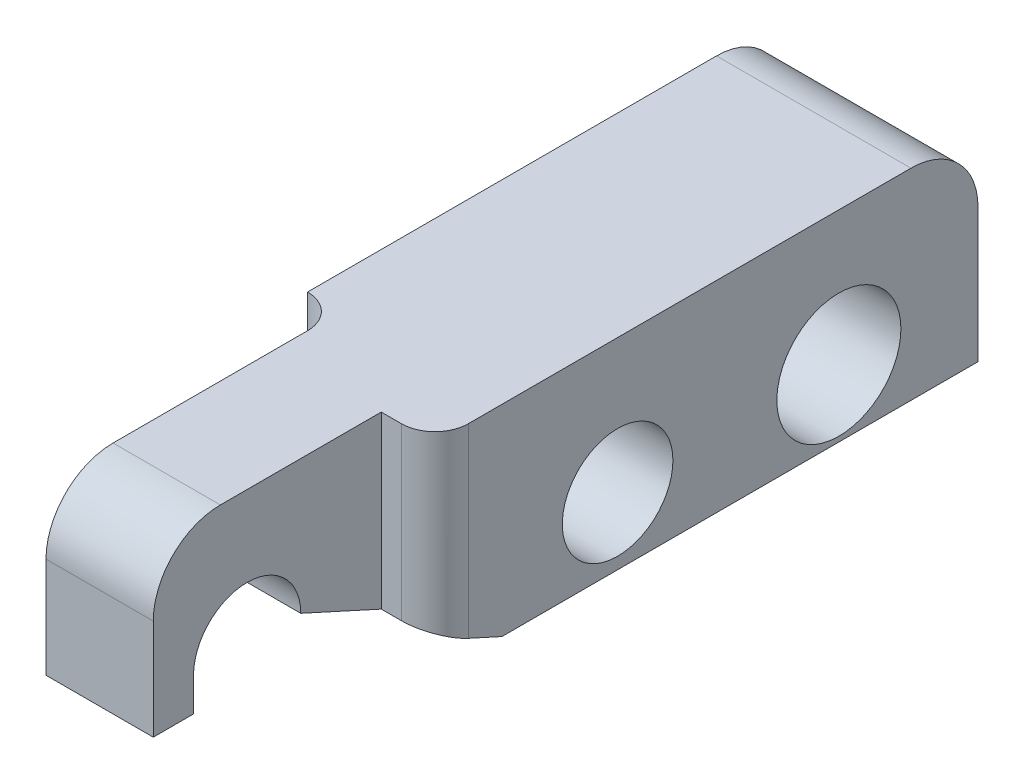
from build123d import *

# Parameters (mm, degrees)
SKETCH_1_W          = 11.5
SKETCH_1_H          = 3
SKETCH_1_R          = 0.925
SKETCH_1_R_2        = 0.825
SKETCH_1_R_3        = 0.8
EXTRUDE_1_DEPTH     = 2.9
CUT_EXTRUDE_1_DEPTH = 11.06184004
SKETCH_2_W          = 0.5
SKETCH_2_H          = 4.4
SKETCH_2_W_2        = 0.8
SKETCH_2_H_2        = 3.4
CUT_EXTRUDE_2_DEPTH = 11.3073093
FILLET_2_R          = 1
FILLET_3_R          = 0.5
SKETCH_3_W          = 47.443490455
SKETCH_3_H          = 29.152776371
CUT_EXTRUDE_3_DEPTH = 16.531922772


with BuildPart() as part:
    # 草图1 → 凸台-拉伸1 (new body)
    with BuildSketch(Plane(origin=(0, 0, 0), x_dir=(0, 0, -1), z_dir=(1, 0, 0))):
        with Locations((-3.675, -0.5)):
            Rectangle(SKETCH_1_W, SKETCH_1_H)
        Circle(SKETCH_1_R, mode=Mode.SUBTRACT)
        with Locations((-3.3, 0)):
            Circle(SKETCH_1_R_2, mode=Mode.SUBTRACT)
        with Locations((-8.025, 0)):
            Circle(SKETCH_1_R_3, mode=Mode.SUBTRACT)
    extrude(amount=EXTRUDE_1_DEPTH)

    # 草图1<11> → 切除-拉伸1 (cut, through all)
    with BuildSketch(Plane(origin=(0, 0, 0), x_dir=(0, 0, -1), z_dir=(1, 0, 0))):
        with BuildLine():
            Line((-8.825, 0.5), (-8.825, 0))
            ThreePointArc((-8.825, 0), (-8.025, 0.8), (-7.225, 0))
            Line((-7.225, 0), (-5.025, 1))
            Line((-5.025, 1), (-9.425, 1))
            Line((-9.425, 1), (-9.425, 0.5))
            Line((-9.425, 0.5), (-8.825, 0.5))
        make_face()
    extrude(amount=CUT_EXTRUDE_1_DEPTH, mode=Mode.SUBTRACT)

    # 草图2 → 切除-拉伸2 (cut, through all)
    with BuildSketch(Plane.XZ.offset(2)):
        with Locations((0.25, 7.225)):
            Rectangle(SKETCH_2_W, SKETCH_2_H)
        with Locations((2.5, 7.725)):
            Rectangle(SKETCH_2_W_2, SKETCH_2_H_2)
    extrude(amount=-CUT_EXTRUDE_2_DEPTH, mode=Mode.SUBTRACT)

    # 圆角2
    fillet_2_edges = [part.edges().sort_by_distance(p)[0] for p in [
        (1.45, -2, -2.075),
        (1.3, -2, 9.425),
    ]]
    fillet(fillet_2_edges, radius=FILLET_2_R)

    # 圆角3
    fillet_3_edges = [part.edges().sort_by_distance(p)[0] for p in [
        (2.9, -0.727272727, 6.025),
        (0.5, -0.5, 5.025),
    ]]
    fillet(fillet_3_edges, radius=FILLET_3_R - 0.0001)  # a hair under: the kernel refuses the full size


with BuildPart() as body_2:
    # 镜向1: mirrored copy
    add(part.part.mirror(Plane.ZX.offset(10)))


with BuildPart() as part_1:
    add(part.part)

    # 草图3 → 切除-拉伸3 (cut, through all)
    with BuildSketch(Plane(origin=(0, 10, 0), x_dir=(1, 0, 0), z_dir=(0, 1, 0))):
        with Locations((5.281098752, -2.215269705)):
            Rectangle(SKETCH_3_W, SKETCH_3_H)
    extrude(amount=-CUT_EXTRUDE_3_DEPTH, mode=Mode.SUBTRACT)


solid = body_2.part
